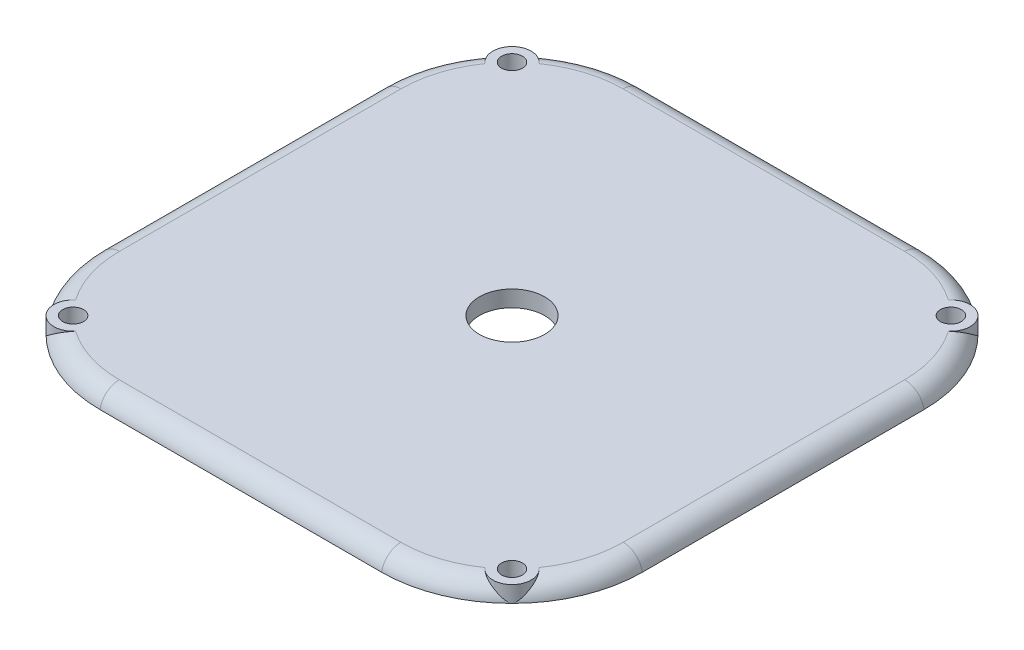
from build123d import *

# Parameters (mm, degrees)
SKETCH1_W           = 83.2
SKETCH1_H           = 83.2
BOSS_EXTRUDE1_DEPTH = 2.5
FILLET1_R           = 20
FILLET2_R           = 3
SKETCH2_R           = 1.6
CUT_EXTRUDE1_DEPTH  = 5
BOSS_EXTRUDE2_START = -2.5
SKETCH4_R           = 2.941812426
SKETCH4_R_2         = 1.6
BOSS_EXTRUDE2_DEPTH = 2.5
SKETCH5_R           = 5
CUT_EXTRUDE2_DEPTH  = 5


with BuildPart() as part:
    # Sketch1 → Boss-Extrude1 (new body)
    with BuildSketch(Plane(origin=(0, 0, 0), x_dir=(1, 0, 0), z_dir=(0, 1, 0))):
        with Locations((-2.816666667, -3.141666667)):
            Rectangle(SKETCH1_W, SKETCH1_H)
    extrude(amount=BOSS_EXTRUDE1_DEPTH)

    # Fillet1
    fillet1_edges = [part.edges().sort_by_distance(p)[0] for p in [
        (-44.416666667, 1.25, -38.458333333),
        (38.783333333, 1.25, -38.458333333),
        (38.783333333, 1.25, 44.741666667),
        (-44.416666667, 1.25, 44.741666667),
    ]]
    fillet(fillet1_edges, radius=FILLET1_R)

    # Fillet2
    # the kernel refuses this fillet: 3 mm, written as the material it takes off along each edge
    with BuildSketch(Plane(origin=(18.783333333, 2.5, -18.458333333), x_dir=(0, 0, -1), z_dir=(-1, 0, 0))) as fillet2_piece_1:
        with BuildLine():
            CenterArc((17.041960108, 3), FILLET2_R, 270, 80.405931773)
            Line((17.041960108, 0), (17.041960108, -0.06))
            Line((17.041960108, -0.06), (20, -0.06))
            Line((20, -0.06), (20.06, 0))
            ThreePointArc((20.06, 0), (20.06, 1.25), (20.059160798, 2.49))
            Line((20.059160798, 2.49), (20, 2.5))
        make_face()
    revolve(axis=Axis((18.783333333, 2.5, -18.458333333), (0, -1, 0)), revolution_arc=90, mode=Mode.SUBTRACT)
    with BuildSketch(Plane(origin=(38.783333333, 2.5, -18.458333333), x_dir=(-1, 0, 0), z_dir=(0, 0, 1)), Plane(origin=(18.783333333, 2.5, 44.741666667), x_dir=(0, 0, -1), z_dir=(-1, 0, 0)), Plane(origin=(-44.416666667, 2.5, 24.741666667), x_dir=(1, 0, 0), z_dir=(0, 0, -1))) as fillet2_piece_2:
        with BuildLine():
            CenterArc((2.958039892, 3), FILLET2_R, 189.594068227, 80.405931773)
            Line((0, 2.5), (-0.059160798, 2.49))
            ThreePointArc((-0.059160798, 2.49), (-0.06, 1.25), (-0.06, 0))
            Line((-0.06, 0), (0, -0.06))
            Line((0, -0.06), (2.958039892, -0.06))
            Line((2.958039892, -0.06), (2.958039892, 0))
        make_face()
    extrude(amount=43.2, mode=Mode.SUBTRACT)
    with BuildSketch(Plane(origin=(18.783333333, 2.5, 24.741666667), x_dir=(1, 0, 0), z_dir=(0, 0, -1))) as fillet2_piece_3:
        with BuildLine():
            CenterArc((17.041960108, 3), FILLET2_R, 270, 80.405931773)
            Line((20, 2.5), (20.059160798, 2.49))
            ThreePointArc((20.059160798, 2.49), (20.06, 1.25), (20.06, 0))
            Line((20.06, 0), (20, -0.06))
            Line((20, -0.06), (17.041960108, -0.06))
            Line((17.041960108, -0.06), (17.041960108, 0))
        make_face()
    revolve(axis=Axis((18.783333333, 2.5, 24.741666667), (0, -1, 0)), revolution_arc=90, mode=Mode.SUBTRACT)
    with BuildSketch(Plane(origin=(-24.416666667, 2.5, 24.741666667), x_dir=(0, 0, 1), z_dir=(1, 0, 0))) as fillet2_piece_4:
        with BuildLine():
            CenterArc((17.041960108, 3), FILLET2_R, 270, 80.405931773)
            Line((20, 2.5), (20.059160798, 2.49))
            ThreePointArc((20.059160798, 2.49), (20.06, 1.25), (20.06, 0))
            Line((20.06, 0), (20, -0.06))
            Line((20, -0.06), (17.041960108, -0.06))
            Line((17.041960108, -0.06), (17.041960108, 0))
        make_face()
    revolve(axis=Axis((-24.416666667, 2.5, 24.741666667), (0, -1, 0)), revolution_arc=90, mode=Mode.SUBTRACT)
    with BuildSketch(Plane(origin=(-24.416666667, 2.5, -18.458333333), x_dir=(0, 0, -1), z_dir=(1, 0, 0))) as fillet2_piece_5:
        with BuildLine():
            CenterArc((17.041960108, -3), FILLET2_R, 9.594068227, 80.405931773)
            Line((17.041960108, 0), (17.041960108, 0.06))
            Line((17.041960108, 0.06), (20, 0.06))
            Line((20, 0.06), (20.06, 0))
            ThreePointArc((20.06, 0), (20.06, -1.25), (20.059160798, -2.49))
            Line((20.059160798, -2.49), (20, -2.5))
        make_face()
    revolve(axis=Axis((-24.416666667, 2.5, -18.458333333), (0, 1, 0)), revolution_arc=90, mode=Mode.SUBTRACT)
    with BuildSketch(Plane(origin=(-24.416666667, 2.5, -38.458333333), x_dir=(0, -1, 0), z_dir=(1, 0, 0))) as fillet2_piece_6:
        with BuildLine():
            CenterArc((3, -2.958039892), FILLET2_R, 99.594068227, 80.405931773)
            Line((0, -2.958039892), (-0.06, -2.958039892))
            Line((-0.06, -2.958039892), (-0.06, 0))
            Line((-0.06, 0), (0, 0.06))
            ThreePointArc((0, 0.06), (1.25, 0.06), (2.49, 0.059160798))
            Line((2.49, 0.059160798), (2.5, 0))
        make_face()
    extrude(amount=43.2, mode=Mode.SUBTRACT)

    # Sketch2 → Cut-Extrude1 (cut)
    with BuildSketch(Plane(origin=(0, 2.5, 0), x_dir=(1, 0, 0), z_dir=(0, 1, 0))):
        with Locations(Location((-36.478626775, 30.520293442, 0), (0, 0, 270))):
            Circle(SKETCH2_R)
        with Locations(Location((30.845293442, 30.520293442, 0), (0, 0, 270))):
            Circle(SKETCH2_R)
        with Locations(Location((30.845293442, -36.803626775, 0), (0, 0, 270))):
            Circle(SKETCH2_R)
        with Locations(Location((-36.478626775, -36.803626775, 0), (0, 0, 270))):
            Circle(SKETCH2_R)
    extrude(amount=-CUT_EXTRUDE1_DEPTH, mode=Mode.SUBTRACT)

    # Sketch4 → Boss-Extrude2 (add)
    # profile 1 of 4: a face of its own
    with BuildSketch(Plane.XZ.offset(BOSS_EXTRUDE2_START)):
        with Locations((-36.478626775, 36.803626775)):
            Circle(SKETCH4_R)
        with Locations(Location((-36.478626775, 36.803626775, 0), (0, 0, 90))):
            Circle(SKETCH4_R_2, mode=Mode.SUBTRACT)
    # profile 2 of 4: a face of its own
    with BuildSketch(Plane.XZ.offset(BOSS_EXTRUDE2_START)):
        with Locations((30.845293442, 36.803626775)):
            Circle(SKETCH4_R)
        with Locations(Location((30.845293442, 36.803626775, 0), (0, 0, 90))):
            Circle(SKETCH4_R_2, mode=Mode.SUBTRACT)
    # profile 3 of 4: a face of its own
    with BuildSketch(Plane.XZ.offset(BOSS_EXTRUDE2_START)):
        with Locations((30.845293442, -30.520293442)):
            Circle(SKETCH4_R)
        with Locations(Location((30.845293442, -30.520293442, 0), (0, 0, 90))):
            Circle(SKETCH4_R_2, mode=Mode.SUBTRACT)
    # profile 4 of 4: a face of its own
    with BuildSketch(Plane.XZ.offset(BOSS_EXTRUDE2_START)):
        with Locations((-36.478626775, -30.520293442)):
            Circle(SKETCH4_R)
        with Locations(Location((-36.478626775, -30.520293442, 0), (0, 0, 90))):
            Circle(SKETCH4_R_2, mode=Mode.SUBTRACT)
    extrude(amount=BOSS_EXTRUDE2_DEPTH)

    # Sketch5 → Cut-Extrude2 (cut)
    with BuildSketch(Plane(origin=(0, 2.5, 0), x_dir=(1, 0, 0), z_dir=(0, 1, 0))):
        with Locations(Location((-2.816666667, -3.141666667, 0), (0, 0, 270))):
            Circle(SKETCH5_R)
    extrude(amount=-CUT_EXTRUDE2_DEPTH, mode=Mode.SUBTRACT)


solid = part.part
